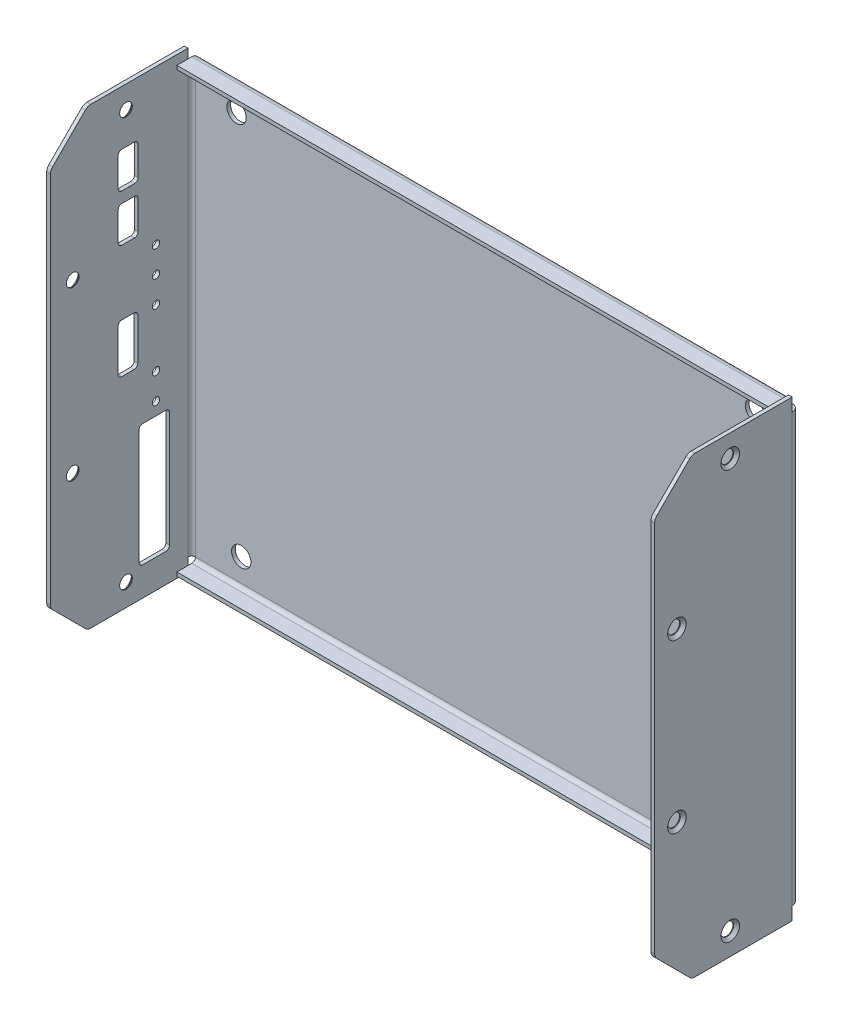
from build123d import *

# Parameters (mm, degrees)
SKETCH1_W                                      = 160.5
SKETCH1_H                                      = 119
BASE_FLANGE1_DEPTH                             = 1
EDGE_FLANGE1_STRIP_W                           = 6.5
EDGE_FLANGE1_STRIP_H                           = 1
EDGE_FLANGE1_STRIP_CUT_DEPTH                   = 119
EDGE_FLANGE1_STRIP_2_W                         = 6.5
EDGE_FLANGE1_STRIP_2_H                         = 1
EDGE_FLANGE1_STRIP_CUT_2_DEPTH                 = 119
EDGE_FLANGE1_DEPTH                             = 119
EDGE_FLANGE1_START                             = 1
EDGE_FLANGE1_FLAT_DEPTH                        = 1
EDGE_FLANGE1_BEND_DEPTH                        = 119
EDGE_FLANGE1_FLAT_2_DEPTH                      = 1
CSK_FOR_M3_FLAT_HEAD_MACHINE_SCREW2_AT_2_COUNT = 2
CSK_FOR_M3_FLAT_HEAD_MACHINE_SCREW2_AT_2_PITCH = 35.518358969
CSK_FOR_M3_FLAT_HEAD_MACHINE_SCREW2_AT_3_COUNT = 2
CSK_FOR_M3_FLAT_HEAD_MACHINE_SCREW2_AT_3_PITCH = 45
CSK_FOR_M3_FLAT_HEAD_MACHINE_SCREW2_AT_4_COUNT = 2
CSK_FOR_M3_FLAT_HEAD_MACHINE_SCREW2_AT_4_PITCH = 78.813411447
F_5_2_5_2_DIAMETER_HOLE1_D                     = 5.2
F_5_2_5_2_DIAMETER_HOLE1_DEPTH                 = 14
F_5_2_5_2_DIAMETER_HOLE1_TIP                   = 1.562237609
SKETCH17_R                                     = 1
SKETCH17_W                                     = 5.4
SKETCH17_H                                     = 9.7
SKETCH17_W_2                                   = 5.3
SKETCH17_H_2                                   = 13.2
CUT_EXTRUDE1_DEPTH                             = 1
FILLET1_R                                      = 1
EDGE_FLANGE2_START                             = -81.75
EDGE_FLANGE2_DEPTH                             = 163.5
EDGE_FLANGE2_2_DEPTH                           = 2
EDGE_FLANGE2_START_2                           = 79.75
EDGE_FLANGE2_3_DEPTH                           = 2
EDGE_FLANGE2_START_3                           = -79.75
EDGE_FLANGE2_4_DEPTH                           = 159.5


# Read off the part's stored shape, not the designer's step: Edge-Flange2
# Sheet-metal steps are written as plain solids
with BuildPart() as part:
    # Sketch1 → Base-Flange1 (new body)
    with BuildSketch(Plane.XY):
        Rectangle(SKETCH1_W, SKETCH1_H)
    extrude(amount=-BASE_FLANGE1_DEPTH)

    # Edge-Flange1 strip (across the edge) → Edge-Flange1 strip cut (cut)
    with BuildSketch(Plane(origin=(-80.75, 59.5, 0), x_dir=(1, 0, 0), z_dir=(0, -1, 0))):
        with Locations((-2.25, -0.5)):
            Rectangle(EDGE_FLANGE1_STRIP_W, EDGE_FLANGE1_STRIP_H)
    extrude(amount=EDGE_FLANGE1_STRIP_CUT_DEPTH, mode=Mode.SUBTRACT)

    # Edge-Flange1 strip 2 (across the edge) → Edge-Flange1 strip cut 2 (cut)
    with BuildSketch(Plane(origin=(80.75, -59.5, 0), x_dir=(-1, 0, 0), z_dir=(0, 1, 0))):
        with Locations((-2.25, -0.5)):
            Rectangle(EDGE_FLANGE1_STRIP_2_W, EDGE_FLANGE1_STRIP_2_H)
    extrude(amount=EDGE_FLANGE1_STRIP_CUT_2_DEPTH, mode=Mode.SUBTRACT)

    # Edge-Flange1 bend section (across the edge) → Edge-Flange1 (add)
    with BuildSketch(Plane(origin=(-80.75, 59.5, 0), x_dir=(1, 0, 0), z_dir=(0, -1, 0))):
        with BuildLine():
            Line((-1, 1), (0, 1))
            ThreePointArc((0, 1), (0.292893219, 0.292893219), (1, 0))
            Line((1, 0), (1, -1))
            ThreePointArc((1, -1), (-0.414213562, -0.414213562), (-1, 1))
        make_face()
    extrude(amount=EDGE_FLANGE1_DEPTH)

    # Edge-Flange1 profile (on flange) → Edge-Flange1 flat (add)
    with BuildSketch(Plane(origin=(-80.75, 0, 0), x_dir=(0, -1, 0), z_dir=(-1, 0, 0)).offset(EDGE_FLANGE1_START)):
        with BuildLine():
            Line((-61, 27.171572875), (-61, 1))
            Line((-61, 1), (61, 1))
            Line((61, 1), (61, 27.171572875))
            ThreePointArc((61, 27.171572875), (60.847759065, 27.93693974), (60.414213562, 28.585786438))
            Line((60.414213562, 28.585786438), (51.585786438, 37.414213562))
            ThreePointArc((51.585786438, 37.414213562), (50.93693974, 37.847759065), (50.171572875, 38))
            Line((50.171572875, 38), (17, 38))
            Line((17, 38), (-16, 38))
            Line((-16, 38), (-50.171572875, 38))
            ThreePointArc((-50.171572875, 38), (-50.93693974, 37.847759065), (-51.585786438, 37.414213562))
            Line((-51.585786438, 37.414213562), (-60.414213562, 28.585786438))
            ThreePointArc((-60.414213562, 28.585786438), (-60.847759065, 27.93693974), (-61, 27.171572875))
        make_face()
    extrude(amount=-EDGE_FLANGE1_FLAT_DEPTH)

    # Edge-Flange1 bend section 2 (across the edge) → Edge-Flange1 bend (add)
    with BuildSketch(Plane(origin=(80.75, -59.5, 0), x_dir=(-1, 0, 0), z_dir=(0, 1, 0))):
        with BuildLine():
            Line((-1, 1), (0, 1))
            ThreePointArc((0, 1), (0.292893219, 0.292893219), (1, 0))
            Line((1, 0), (1, -1))
            ThreePointArc((1, -1), (-0.414213562, -0.414213562), (-1, 1))
        make_face()
    extrude(amount=EDGE_FLANGE1_BEND_DEPTH)

    # Edge-Flange1 profile 2 (on flange) → Edge-Flange1 flat 2 (add)
    with BuildSketch(Plane.YZ.offset(80.75).offset(EDGE_FLANGE1_START)):
        with BuildLine():
            ThreePointArc((-60.414213562, 28.585786438), (-60.847759065, 27.93693974), (-61, 27.171572875))
            Line((-61, 27.171572875), (-61, 1))
            Line((-61, 1), (61, 1))
            Line((61, 1), (61, 27.171572875))
            ThreePointArc((61, 27.171572875), (60.847759065, 27.93693974), (60.414213562, 28.585786438))
            Line((60.414213562, 28.585786438), (51.585786438, 37.414213562))
            ThreePointArc((51.585786438, 37.414213562), (50.93693974, 37.847759065), (50.171572875, 38))
            Line((50.171572875, 38), (16, 38))
            Line((16, 38), (-17, 38))
            Line((-17, 38), (-50.171572875, 38))
            ThreePointArc((-50.171572875, 38), (-50.93693974, 37.847759065), (-51.585786438, 37.414213562))
            Line((-51.585786438, 37.414213562), (-60.414213562, 28.585786438))
        make_face()
    extrude(amount=-EDGE_FLANGE1_FLAT_2_DEPTH)

    # Sketch11 → CSK for M3 Flat Head Machine Screw2 (revolve, cut)
    with BuildSketch(Plane(origin=(-81.75, 22.5, 32), x_dir=(0, 0, 1), z_dir=(0, 1, 0))):
        Polygon((0, 0), (0, 15.021463052), (1.7, 14), (1.7, 0.8), (2.5, 0), align=None)
    csk_for_m3_flat_head_machine_screw2 = revolve(axis=Axis((-88.1, 22.5, 32), (1, 0, 0)), mode=Mode.SUBTRACT)

    # CSK for M3 Flat Head Machine Screw2 at 2: CSK for M3 Flat Head Machine Screw2 ×2
    with Locations(*[Vector(1.4003459885704356e-15, 0.9150197515636448, -0.40340904086101714) * (i * CSK_FOR_M3_FLAT_HEAD_MACHINE_SCREW2_AT_2_PITCH) for i in range(1, CSK_FOR_M3_FLAT_HEAD_MACHINE_SCREW2_AT_2_COUNT)]):
        add(csk_for_m3_flat_head_machine_screw2, mode=Mode.SUBTRACT)

    # CSK for M3 Flat Head Machine Screw2 at 3: CSK for M3 Flat Head Machine Screw2 ×2
    with Locations(*[(0, -i * CSK_FOR_M3_FLAT_HEAD_MACHINE_SCREW2_AT_3_PITCH, 0) for i in range(1, CSK_FOR_M3_FLAT_HEAD_MACHINE_SCREW2_AT_3_COUNT)]):
        add(csk_for_m3_flat_head_machine_screw2, mode=Mode.SUBTRACT)

    # CSK for M3 Flat Head Machine Screw2 at 4: CSK for M3 Flat Head Machine Screw2 ×2
    with Locations(*[Vector(0, -0.9833351783331594, -0.18180188957349616) * (i * CSK_FOR_M3_FLAT_HEAD_MACHINE_SCREW2_AT_4_PITCH) for i in range(1, CSK_FOR_M3_FLAT_HEAD_MACHINE_SCREW2_AT_4_COUNT)]):
        add(csk_for_m3_flat_head_machine_screw2, mode=Mode.SUBTRACT)

    # Mirror1: CSK for M3 Flat Head Machine Screw2 across plane
    add(csk_for_m3_flat_head_machine_screw2.mirror(Plane(origin=(0, 0, 0), x_dir=(0, 0, 1), z_dir=(1, 0, 0))), mode=Mode.SUBTRACT)

    # Mirror1 copy 1 sketch → Mirror1 copy 1 (revolve, cut)
    with BuildSketch(Plane(origin=(81.75, 55, 17.671572875), x_dir=(0, 0, 1), z_dir=(0, 1, 0))):
        Polygon((0, 0), (0, -15.021463052), (1.7, -14), (1.7, -0.8), (2.5, 0), align=None)
    revolve(axis=Axis((88.1, 55, 17.671572875), (1, 0, 0)), mode=Mode.SUBTRACT)

    # Mirror1 copy 2 sketch → Mirror1 copy 2 (revolve, cut)
    with BuildSketch(Plane(origin=(81.75, -22.5, 32), x_dir=(0, 0, 1), z_dir=(0, 1, 0))):
        Polygon((0, 0), (0, -15.021463052), (1.7, -14), (1.7, -0.8), (2.5, 0), align=None)
    revolve(axis=Axis((88.1, -22.5, 32), (1, 0, 0)), mode=Mode.SUBTRACT)

    # Mirror1 copy 3 sketch → Mirror1 copy 3 (revolve, cut)
    with BuildSketch(Plane(origin=(81.75, -55, 17.671572875), x_dir=(0, 0, 1), z_dir=(0, 1, 0))):
        Polygon((0, 0), (0, -15.021463052), (1.7, -14), (1.7, -0.8), (2.5, 0), align=None)
    revolve(axis=Axis((88.1, -55, 17.671572875), (1, 0, 0)), mode=Mode.SUBTRACT)

    # Ø5.2 (5.2) Diameter Hole1
    with Locations(Plane(origin=(0, 0, -1), x_dir=(-1, 0, 0), z_dir=(0, 0, -1))):
        with Locations((-70.74499876, 51.71999943), (-69.34799876, -50.26100057), (67.43100124, -51.27700057), (68.70100124, 51.59299943)):
            Hole(F_5_2_5_2_DIAMETER_HOLE1_D / 2, depth=F_5_2_5_2_DIAMETER_HOLE1_DEPTH)
            with Locations((0, 0, -(F_5_2_5_2_DIAMETER_HOLE1_DEPTH + F_5_2_5_2_DIAMETER_HOLE1_TIP / 2))):  # 118° drill point
                Cone(0, F_5_2_5_2_DIAMETER_HOLE1_D / 2, F_5_2_5_2_DIAMETER_HOLE1_TIP, mode=Mode.SUBTRACT)

    # Sketch17 → Cut-Extrude1 (cut)
    with BuildSketch(Plane.ZY.offset(81.75)):
        with Locations((9.61148, -16.93699963)):
            Circle(SKETCH17_R)
        with Locations((9.61148, -9.93699963)):
            Circle(SKETCH17_R)
        with Locations((9.61148, 5.56300037)):
            Circle(SKETCH17_R)
        with Locations((9.61148, 12.56300037)):
            Circle(SKETCH17_R)
        with Locations((9.61148, 19.56300037)):
            Circle(SKETCH17_R)
        with Locations((17.1, 41.5)):
            Rectangle(SKETCH17_W, SKETCH17_H)
        with Locations((17.15, 0)):
            Rectangle(SKETCH17_W_2, SKETCH17_H_2)
        Polygon((14.162732109, -53.24517671), (14.162732109, -20.353414123), (5.96148, -20.35341396), (5.96148, -53.245176873), align=None)
        with Locations((17.1, 28.85)):
            Rectangle(SKETCH17_W, SKETCH17_H)
    extrude(amount=-CUT_EXTRUDE1_DEPTH, mode=Mode.SUBTRACT)

    # Fillet1
    fillet1_edges = [part.edges().sort_by_distance(p)[0] for p in [
        (-81.25, -6.6, 19.8),
        (-81.25, -6.6, 14.5),
        (-81.25, 6.6, 14.5),
        (-81.25, 6.6, 19.8),
        (-81.25, -53.24517671, 14.162732109),
        (-81.25, -53.245176873, 5.96148),
        (-81.25, -20.35341396, 5.96148),
        (-81.25, -20.353414123, 14.162732109),
        (-81.25, 33.7, 14.4),
        (-81.25, 33.7, 19.8),
        (-81.25, 24, 19.8),
        (-81.25, 24, 14.4),
        (-81.25, 46.35, 19.8),
        (-81.25, 36.65, 19.8),
        (-81.25, 36.65, 14.4),
        (-81.25, 46.35, 14.4),
    ]]
    fillet(fillet1_edges, radius=FILLET1_R)

    # Edge-Flange2 outline → Edge-Flange2 (cut)
    with BuildSketch(Plane.YZ.offset(EDGE_FLANGE2_START)):
        with BuildLine():
            Line((-59.5, 1), (-59.5, -1))
            Line((-59.5, -1), (-57.5, -1))
            ThreePointArc((-57.5, -1), (-58.914213562, -0.414213562), (-59.5, 1))
        make_face()
        with BuildLine():
            Line((-57.5, 1), (-58.5, 1))
            ThreePointArc((-58.5, 1), (-58.207106781, 0.292893219), (-57.5, 0))
            Line((-57.5, 0), (-57.5, 1))
        make_face()
        with BuildLine():
            Line((57.5, 1), (57.5, 0))
            ThreePointArc((57.5, 0), (58.207106781, 0.292893219), (58.5, 1))
            Line((58.5, 1), (57.5, 1))
        make_face()
        with BuildLine():
            Line((57.5, -1), (59.5, -1))
            Line((59.5, -1), (59.5, 1))
            ThreePointArc((59.5, 1), (58.914213562, -0.414213562), (57.5, -1))
        make_face()
    extrude(amount=EDGE_FLANGE2_DEPTH, mode=Mode.SUBTRACT)

    # Edge-Flange2 2 outline → Edge-Flange2 2 (cut)
    with BuildSketch(Plane.YZ.offset(EDGE_FLANGE2_START)):
        with BuildLine():
            Line((-58.5, 1), (-59.5, 1))
            ThreePointArc((-59.5, 1), (-58.914213562, -0.414213562), (-57.5, -1))
            Line((-57.5, -1), (-57.5, 0))
            ThreePointArc((-57.5, 0), (-58.207106781, 0.292893219), (-58.5, 1))
        make_face()
        with BuildLine():
            ThreePointArc((57.5, -1), (58.914213562, -0.414213562), (59.5, 1))
            Line((59.5, 1), (58.5, 1))
            ThreePointArc((58.5, 1), (58.207106781, 0.292893219), (57.5, 0))
            Line((57.5, 0), (57.5, -1))
        make_face()
    extrude(amount=EDGE_FLANGE2_2_DEPTH, mode=Mode.SUBTRACT)

    # Edge-Flange2 3 outline → Edge-Flange2 3 (cut)
    with BuildSketch(Plane.YZ.offset(EDGE_FLANGE2_START_2)):
        with BuildLine():
            Line((-58.5, 1), (-59.5, 1))
            ThreePointArc((-59.5, 1), (-58.914213562, -0.414213562), (-57.5, -1))
            Line((-57.5, -1), (-57.5, 0))
            ThreePointArc((-57.5, 0), (-58.207106781, 0.292893219), (-58.5, 1))
        make_face()
        with BuildLine():
            ThreePointArc((57.5, -1), (58.914213562, -0.414213562), (59.5, 1))
            Line((59.5, 1), (58.5, 1))
            ThreePointArc((58.5, 1), (58.207106781, 0.292893219), (57.5, 0))
            Line((57.5, 0), (57.5, -1))
        make_face()
    extrude(amount=EDGE_FLANGE2_3_DEPTH, mode=Mode.SUBTRACT)

    # Edge-Flange2 4 outline → Edge-Flange2 4 (add)
    with BuildSketch(Plane.YZ.offset(EDGE_FLANGE2_START_3)):
        with BuildLine():
            Line((-59.5, 5), (-59.5, 1))
            ThreePointArc((-59.5, 1), (-59.431851652, 0.48236191), (-59.232050807, 0))
            Line((-59.232050807, 0), (-57.5, 0))
            ThreePointArc((-57.5, 0), (-58.207106781, 0.292893219), (-58.5, 1))
            Line((-58.5, 1), (-58.5, 5))
            Line((-58.5, 5), (-59.5, 5))
        make_face()
        with BuildLine():
            ThreePointArc((58.5, 1), (58.207106781, 0.292893219), (57.5, 0))
            Line((57.5, 0), (59.232050807, 0))
            ThreePointArc((59.232050807, 0), (59.431851652, 0.48236191), (59.5, 1))
            Line((59.5, 1), (59.5, 5))
            Line((59.5, 5), (58.5, 5))
            Line((58.5, 5), (58.5, 1))
        make_face()
    extrude(amount=EDGE_FLANGE2_4_DEPTH)


solid = part.part
